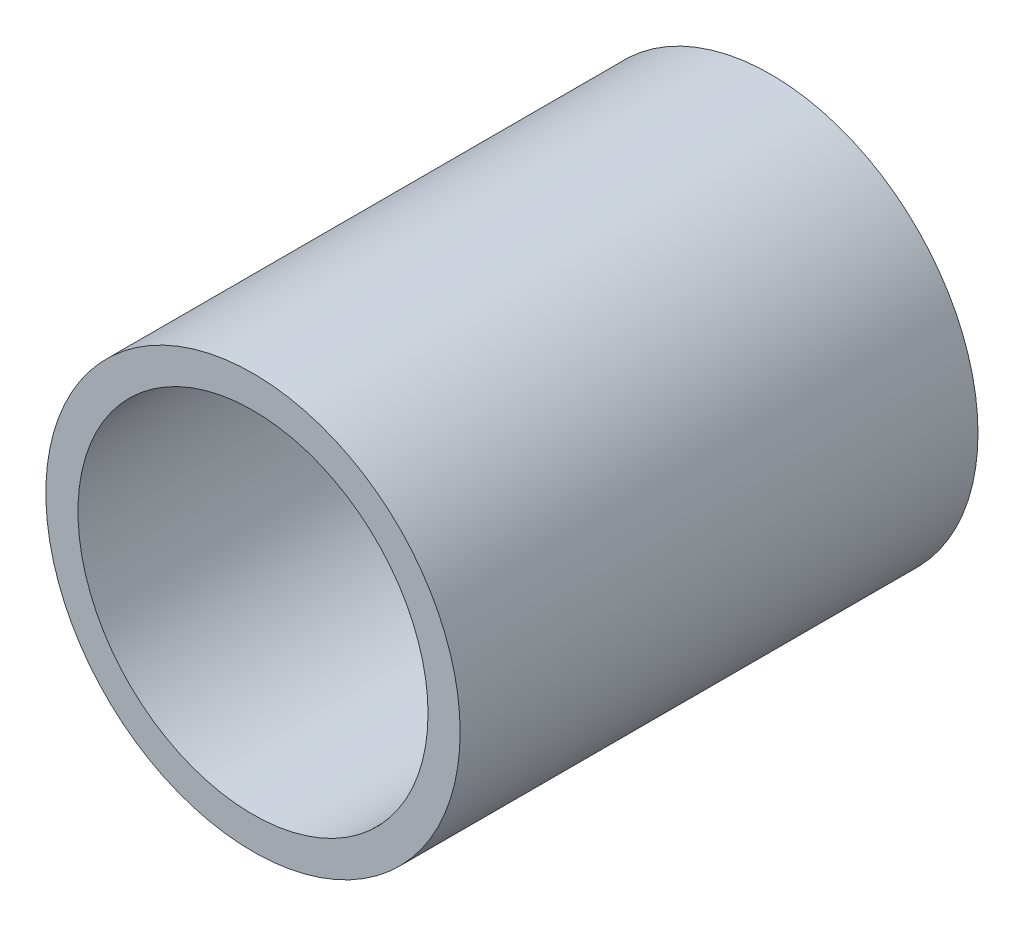
from build123d import *

# Parameters (mm, degrees)
SKETCH1_R           = 25.4
SKETCH1_R_2         = 21.463
BOSS_EXTRUDE1_DEPTH = 63.5


with BuildPart() as part:
    # Sketch1 → Boss-Extrude1 (new body)
    with BuildSketch(Plane.XY):
        Circle(SKETCH1_R)
        Circle(SKETCH1_R_2, mode=Mode.SUBTRACT)
    extrude(amount=BOSS_EXTRUDE1_DEPTH)


solid = part.part
